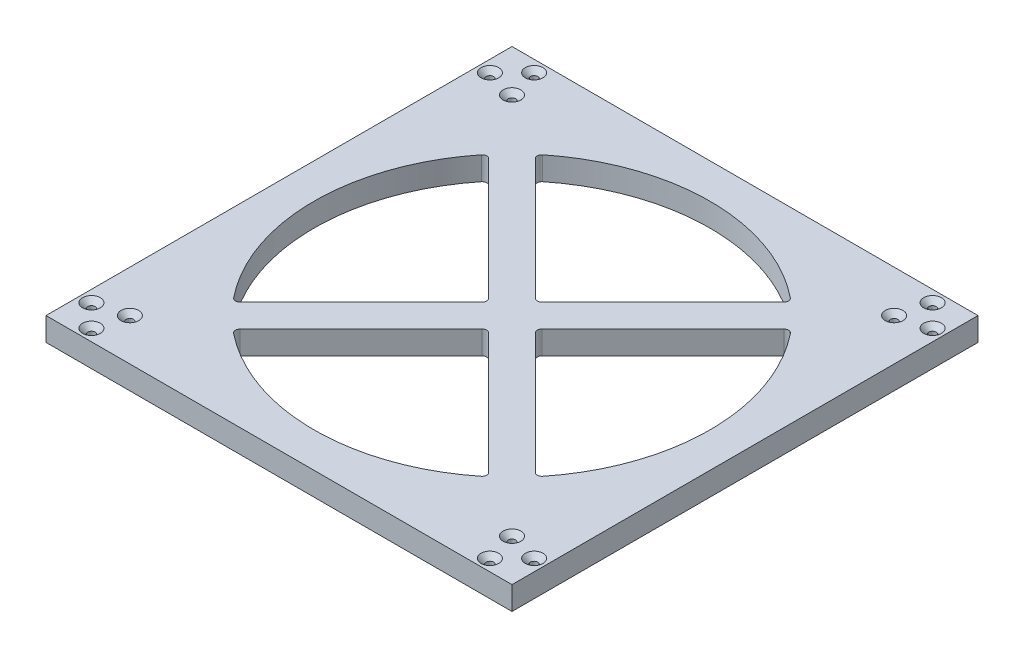
from build123d import *

# Parameters (mm, degrees)
SKETCH2_W                             = 100
SKETCH2_H                             = 100
BOSS_EXTRUDE2_DEPTH                   = 5
TAP_DRILL_FOR_M2X0_4_TAP1_D           = 1.6
TAP_DRILL_FOR_M2X0_4_TAP1_CSINK_D     = 3.8
TAP_DRILL_FOR_M2X0_4_TAP1_CSINK_ANGLE = 90
TAP_DRILL_FOR_M2X0_4_TAP2_D           = 1.6
TAP_DRILL_FOR_M2X0_4_TAP2_CSINK_D     = 3.8
TAP_DRILL_FOR_M2X0_4_TAP2_CSINK_ANGLE = 90
CIRPATTERN1_COUNT                     = 4


with BuildPart() as part:
    # Sketch2 → Boss-Extrude2 (new body)
    with BuildSketch(Plane(origin=(0, 0, 0), x_dir=(1, 0, 0), z_dir=(0, 1, 0))):
        with Locations((50, 50)):
            Rectangle(SKETCH2_W, SKETCH2_H)
        with BuildLine():
            Line((23.330847354, 81.669152646), (49.292893219, 55.707106781))
            ThreePointArc((49.292893219, 55.707106781), (50, 55.414213562), (50.707106781, 55.707106781))
            Line((50.707106781, 55.707106781), (76.669152646, 81.669152646))
            ThreePointArc((76.669152646, 81.669152646), (76.96054722, 82.430986431), (76.587637332, 83.156410257))
            ThreePointArc((76.587637332, 83.156410257), (50, 92.5), (23.412362668, 83.156410257))
            ThreePointArc((23.412362668, 83.156410257), (23.03945278, 82.430986431), (23.330847354, 81.669152646))
        make_face(mode=Mode.SUBTRACT)
        with BuildLine():
            Line((81.669152646, 76.669152646), (55.707106781, 50.707106781))
            ThreePointArc((55.707106781, 50.707106781), (55.414213562, 50), (55.707106781, 49.292893219))
            Line((55.707106781, 49.292893219), (81.669152646, 23.330847354))
            ThreePointArc((81.669152646, 23.330847354), (82.430986431, 23.03945278), (83.156410257, 23.412362668))
            ThreePointArc((83.156410257, 23.412362668), (92.5, 50), (83.156410257, 76.587637332))
            ThreePointArc((83.156410257, 76.587637332), (82.430986431, 76.96054722), (81.669152646, 76.669152646))
        make_face(mode=Mode.SUBTRACT)
        with BuildLine():
            Line((76.669152646, 18.330847354), (50.707106781, 44.292893219))
            ThreePointArc((50.707106781, 44.292893219), (50, 44.585786438), (49.292893219, 44.292893219))
            Line((49.292893219, 44.292893219), (23.330847354, 18.330847354))
            ThreePointArc((23.330847354, 18.330847354), (23.03945278, 17.569013569), (23.412362668, 16.843589743))
            ThreePointArc((23.412362668, 16.843589743), (50, 7.5), (76.587637332, 16.843589743))
            ThreePointArc((76.587637332, 16.843589743), (76.96054722, 17.569013569), (76.669152646, 18.330847354))
        make_face(mode=Mode.SUBTRACT)
        with BuildLine():
            Line((18.330847354, 23.330847354), (44.292893219, 49.292893219))
            ThreePointArc((44.292893219, 49.292893219), (44.585786438, 50), (44.292893219, 50.707106781))
            Line((44.292893219, 50.707106781), (18.330847354, 76.669152646))
            ThreePointArc((18.330847354, 76.669152646), (17.569013569, 76.96054722), (16.843589743, 76.587637332))
            ThreePointArc((16.843589743, 76.587637332), (7.5, 50), (16.843589743, 23.412362668))
            ThreePointArc((16.843589743, 23.412362668), (17.569013569, 23.03945278), (18.330847354, 23.330847354))
        make_face(mode=Mode.SUBTRACT)
    extrude(amount=BOSS_EXTRUDE2_DEPTH)

    # Tap Drill for M2x0.4 Tap1 (through all)
    with Locations(Plane(origin=(9, 5, -9), x_dir=(0, 0, 1), z_dir=(0, 1, 0))):
        with Locations((0, 0), (-82, 0), (-82, 82), (0, 82)):
            CounterSinkHole(TAP_DRILL_FOR_M2X0_4_TAP1_D / 2, TAP_DRILL_FOR_M2X0_4_TAP1_CSINK_D / 2, counter_sink_angle=TAP_DRILL_FOR_M2X0_4_TAP1_CSINK_ANGLE)

    # Tap Drill for M2x0.4 Tap2 (through all)
    with Locations(Plane(origin=(2.5, 5, -7.25), x_dir=(0, 0, 1), z_dir=(0, 1, 0))):
        with Locations((0, 0), (4.75, 4.75)):
            tap_drill_for_m2x0_4_tap2 = CounterSinkHole(TAP_DRILL_FOR_M2X0_4_TAP2_D / 2, TAP_DRILL_FOR_M2X0_4_TAP2_CSINK_D / 2, counter_sink_angle=TAP_DRILL_FOR_M2X0_4_TAP2_CSINK_ANGLE)

    # CirPattern1: Tap Drill for M2x0.4 Tap2 ×4 about axis
    cirpattern1_axis = Axis((50, 5, -50), (0, -1, 0))
    for i in range(1, CIRPATTERN1_COUNT):
        add(tap_drill_for_m2x0_4_tap2.rotate(cirpattern1_axis, i * 360 / CIRPATTERN1_COUNT), mode=Mode.SUBTRACT)


solid = part.part
